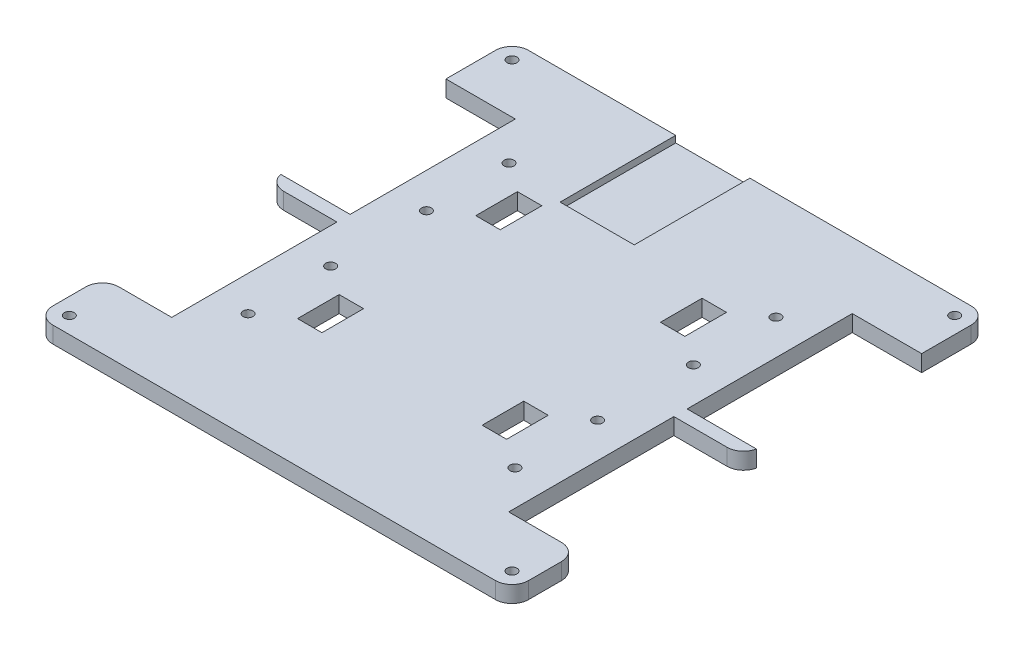
from build123d import *

# Parameters (mm, degrees)
SKETCH1_W           = 144
SKETCH1_H           = 144
BOSS_EXTRUDE1_DEPTH = 5
SKETCH2_W           = 21
SKETCH2_H           = 50
CUT_EXTRUDE1_DEPTH  = 5
SKETCH11_W          = 7.4
SKETCH11_H          = 12.6
CUT_EXTRUDE10_DEPTH = 5
SKETCH13_R          = 1.5
CUT_EXTRUDE12_DEPTH = 5
FILLET1_R           = 5
FILLET2_R           = 5
FILLET3_R           = 5
SKETCH14_R          = 1.5
CUT_EXTRUDE13_DEPTH = 5
SKETCH15_W          = 22.44
SKETCH15_H          = 35
CUT_EXTRUDE14_DEPTH = 2


with BuildPart() as part:
    # Sketch1 → Boss-Extrude1 (new body)
    with BuildSketch(Plane(origin=(0, 0, 0), x_dir=(1, 0, 0), z_dir=(0, 1, 0))):
        Rectangle(SKETCH1_W, SKETCH1_H)
    extrude(amount=BOSS_EXTRUDE1_DEPTH)

    # Sketch2 → Cut-Extrude1 (cut)
    with BuildSketch(Plane(origin=(0, 5, 0), x_dir=(1, 0, 0), z_dir=(0, 1, 0))):
        with Locations((-61.5, -27)):
            Rectangle(SKETCH2_W, SKETCH2_H)
        with Locations((61.5, -27)):
            Rectangle(SKETCH2_W, SKETCH2_H)
        with Locations((61.5, 27)):
            Rectangle(SKETCH2_W, SKETCH2_H)
        with Locations((-61.5, 27)):
            Rectangle(SKETCH2_W, SKETCH2_H)
    extrude(amount=-CUT_EXTRUDE1_DEPTH, mode=Mode.SUBTRACT)

    # Sketch11 → Cut-Extrude10 (cut)
    with BuildSketch(Plane(origin=(0, 5, 0), x_dir=(1, 0, 0), z_dir=(0, 1, 0))):
        with Locations((27.945388191, -26.98248673)):
            Rectangle(SKETCH11_W, SKETCH11_H)
        with Locations((-27.945388191, -26.98248673)):
            Rectangle(SKETCH11_W, SKETCH11_H)
        with Locations((27.945388191, 26.98248673)):
            Rectangle(SKETCH11_W, SKETCH11_H)
        with Locations((-27.945388191, 26.98248673)):
            Rectangle(SKETCH11_W, SKETCH11_H)
    extrude(amount=-CUT_EXTRUDE10_DEPTH, mode=Mode.SUBTRACT)

    # Sketch13 → Cut-Extrude12 (cut)
    with BuildSketch(Plane(origin=(0, 5, 0), x_dir=(1, 0, 0), z_dir=(0, 1, 0))):
        with Locations(Location((-67, 67, 0), (0, 0, 270))):
            Circle(SKETCH13_R)
        with Locations(Location((-67, -67, 0), (0, 0, 270))):
            Circle(SKETCH13_R)
        with Locations(Location((67, 67, 0), (0, 0, 270))):
            Circle(SKETCH13_R)
        with Locations(Location((67, -67, 0), (0, 0, 270))):
            Circle(SKETCH13_R)
    extrude(amount=-CUT_EXTRUDE12_DEPTH, mode=Mode.SUBTRACT)

    # Fillet1
    fillet1_edges = [part.edges().sort_by_distance(p)[0] for p in [
        (-72, 2.5, -72),
    ]]
    fillet(fillet1_edges, radius=FILLET1_R)

    # Fillet2
    # the kernel refuses this fillet: 5 mm, written as the material it takes off along each edge
    with BuildSketch(Plane(origin=(-72, 17.5, 52), x_dir=(1, 0, 0), z_dir=(0, -1, 0))) as fillet2_piece_1:
        with BuildLine():
            CenterArc((FILLET2_R, FILLET2_R), FILLET2_R, 180, 90)
            Line((0, FILLET2_R), (-FILLET2_R * 0.02, FILLET2_R))
            Line((-FILLET2_R * 0.02, FILLET2_R), (-FILLET2_R * 0.02, -FILLET2_R * 0.02))
            Line((-FILLET2_R * 0.02, -FILLET2_R * 0.02), (FILLET2_R, -FILLET2_R * 0.02))
            Line((FILLET2_R, -FILLET2_R * 0.02), (FILLET2_R, 0))
        make_face()
    extrude(amount=30, mode=Mode.SUBTRACT)
    with BuildSketch(Plane(origin=(-72, 17.247448714, 2), x_dir=(1.5631940186717212e-12, 0, -1.0), z_dir=(0, -1, 0))) as fillet2_piece_2:
        with BuildLine():
            CenterArc((5, 4.898979486), FILLET2_R, 180, 78.463040967)
            Line((0, 4.898979486), (-0.1, 4.898979486))
            Line((-0.1, 4.898979486), (-0.1, 0))
            Line((-0.1, 0), (0, -0.1))
            ThreePointArc((0, -0.1), (2, -0.1), (3.98, -0.09797959))
            Line((3.98, -0.09797959), (4, 0))
        make_face()
    extrude(amount=29.494897428, mode=Mode.SUBTRACT)
    with BuildSketch(Plane(origin=(-72, -12.5, 72), x_dir=(0, 0, -1), z_dir=(0, 1, 0))) as fillet2_piece_3:
        with BuildLine():
            CenterArc((FILLET2_R, -FILLET2_R), FILLET2_R, 90, 90)
            Line((0, -FILLET2_R), (-FILLET2_R * 0.02, -FILLET2_R))
            Line((-FILLET2_R * 0.02, -FILLET2_R), (-FILLET2_R * 0.02, FILLET2_R * 0.02))
            Line((-FILLET2_R * 0.02, FILLET2_R * 0.02), (FILLET2_R, FILLET2_R * 0.02))
            Line((FILLET2_R, FILLET2_R * 0.02), (FILLET2_R, 0))
        make_face()
    extrude(amount=30, mode=Mode.SUBTRACT)

    # Fillet3
    # the kernel refuses this fillet: 5 mm, written as the material it takes off along each edge
    with BuildSketch(Plane(origin=(72, 17.247448714, 2), x_dir=(-1, 0, 0), z_dir=(0, -1, 0))) as fillet3_piece_1:
        with BuildLine():
            CenterArc((4.898979486, 5), FILLET3_R, 191.536959033, 78.463040967)
            Line((0, 4), (-0.09797959, 3.98))
            ThreePointArc((-0.09797959, 3.98), (-0.1, 2), (-0.1, 0))
            Line((-0.1, 0), (0, -0.1))
            Line((0, -0.1), (4.898979486, -0.1))
            Line((4.898979486, -0.1), (4.898979486, 0))
        make_face()
    extrude(amount=29.494897428, mode=Mode.SUBTRACT)
    with BuildSketch(Plane(origin=(72, 17.5, 52), x_dir=(0, 0, 1), z_dir=(0, -1, 0)), Plane(origin=(72, -12.5, -72), x_dir=(-1, 0, 0), z_dir=(0, 1, 0))) as fillet3_piece_2:
        with BuildLine():
            CenterArc((FILLET3_R, FILLET3_R), FILLET3_R, 180, 90)
            Line((0, FILLET3_R), (-FILLET3_R * 0.02, FILLET3_R))
            Line((-FILLET3_R * 0.02, FILLET3_R), (-FILLET3_R * 0.02, -FILLET3_R * 0.02))
            Line((-FILLET3_R * 0.02, -FILLET3_R * 0.02), (FILLET3_R, -FILLET3_R * 0.02))
            Line((FILLET3_R, -FILLET3_R * 0.02), (FILLET3_R, 0))
        make_face()
    extrude(amount=30, mode=Mode.SUBTRACT)
    with BuildSketch(Plane(origin=(72, -12.5, 72), x_dir=(-1, 0, 0), z_dir=(0, 1, 0))) as fillet3_piece_3:
        with BuildLine():
            CenterArc((FILLET3_R, -FILLET3_R), FILLET3_R, 90, 90)
            Line((0, -FILLET3_R), (-FILLET3_R * 0.02, -FILLET3_R))
            Line((-FILLET3_R * 0.02, -FILLET3_R), (-FILLET3_R * 0.02, FILLET3_R * 0.02))
            Line((-FILLET3_R * 0.02, FILLET3_R * 0.02), (FILLET3_R, FILLET3_R * 0.02))
            Line((FILLET3_R, FILLET3_R * 0.02), (FILLET3_R, 0))
        make_face()
    extrude(amount=30, mode=Mode.SUBTRACT)

    # Sketch14 → Cut-Extrude13 (cut)
    with BuildSketch(Plane.XZ):
        with Locations(Location((-40.4, 39.5, 0), (0, 0, 270))):
            Circle(SKETCH14_R)
        with Locations(Location((-40.4, 14.5, 0), (0, 0, 270))):
            Circle(SKETCH14_R)
        with Locations(Location((40.4, 39.5, 0), (0, 0, 270))):
            Circle(SKETCH14_R)
        with Locations(Location((40.4, 14.5, 0), (0, 0, 270))):
            Circle(SKETCH14_R)
        with Locations(Location((-40.4, -14.5, 0), (0, 0, 270))):
            Circle(SKETCH14_R)
        with Locations(Location((-40.4, -39.5, 0), (0, 0, 270))):
            Circle(SKETCH14_R)
        with Locations(Location((40.4, -14.5, 0), (0, 0, 270))):
            Circle(SKETCH14_R)
        with Locations(Location((40.4, -39.5, 0), (0, 0, 270))):
            Circle(SKETCH14_R)
    extrude(amount=-CUT_EXTRUDE13_DEPTH, mode=Mode.SUBTRACT)

    # Sketch15 → Cut-Extrude14 (cut)
    with BuildSketch(Plane(origin=(0, 5, 0), x_dir=(1, 0, 0), z_dir=(0, 1, 0))):
        with Locations((-11.22, 54.5)):
            Rectangle(SKETCH15_W, SKETCH15_H)
    extrude(amount=-CUT_EXTRUDE14_DEPTH, mode=Mode.SUBTRACT)


solid = part.part
